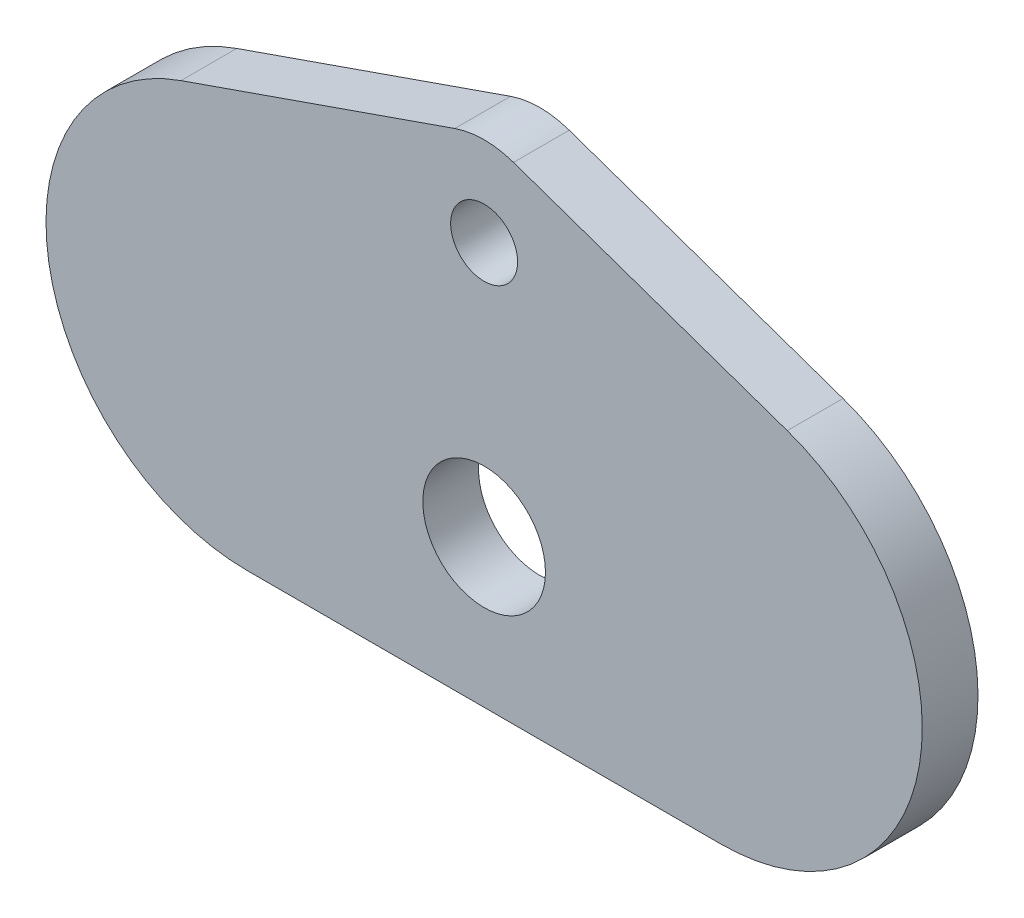
from build123d import *

# Parameters (mm, degrees)
SKETCH1_R           = 6
SKETCH1_R_2         = 11
BOSS_EXTRUDE1_DEPTH = 10


with BuildPart() as part:
    # Sketch1 → Boss-Extrude1 (new body)
    with BuildSketch(Plane.XY):
        with BuildLine():
            ThreePointArc((5.266349667, -0.891540079), (0, 0), (-5.266349667, -0.891540079))
            Line((-5.266349667, -0.891540079), (-54.380555702, -18.011258697))
            ThreePointArc((-54.380555702, -18.011258697), (-78.08863349, -58.119798033), (-42.5, -88.19))
            Line((-42.5, -88.19), (42.5, -88.19))
            ThreePointArc((42.5, -88.19), (78.08863349, -58.119798033), (54.380555702, -18.011258697))
            Line((54.380555702, -18.011258697), (5.266349667, -0.891540079))
        make_face()
        with Locations((0, -16)):
            Circle(SKETCH1_R, mode=Mode.SUBTRACT)
        with Locations((0, -61.697507746)):
            Circle(SKETCH1_R_2, mode=Mode.SUBTRACT)
    extrude(amount=BOSS_EXTRUDE1_DEPTH)


solid = part.part
